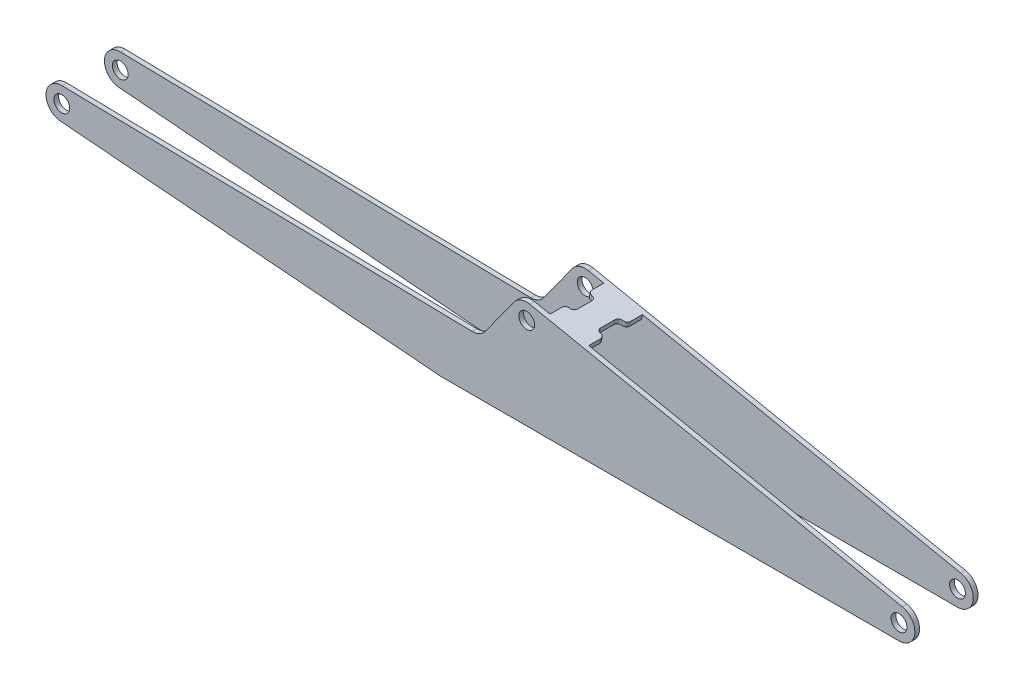
from build123d import *

# Parameters (mm, degrees)
PROFILE_EXTRUDE_DEPTH        = 40
LIGHTNING_BOLT_FILLET_R      = 10
SHELL_CUT_REACH              = 291.378
SHELL_SKETCH_W               = 549.904110801
SHELL_SKETCH_H               = 34
HOLES_START                  = -40
HOLES_SKETCH_R               = 5
HOLES_CUT_DEPTH              = 40
BOWTIE_SUPPORT_EXTRUDE_DEPTH = 3
BOWTIE_SUPPORT_FILLET_R      = 2.5


# Some blends are built 0.0001 mm under size
with BuildPart() as part:
    # Profile Sketch → Profile Extrude (new body)
    with BuildSketch(Plane.XY):
        with BuildLine():
            Line((-25, -34.499500189), (-265.820932486, -14.965628235))
            ThreePointArc((-265.820932486, -14.965628235), (-275, -4.499500189), (-264.823685281, 4.999854285))
            Line((-264.823685281, 4.999854285), (0, 0))
            Line((0, 0), (25, 34.499500189))
            Line((25, 34.499500189), (267.042170119, -14.699900238))
            ThreePointArc((267.042170119, -14.699900238), (275, -25.500499811), (265.050226145, -34.499500189))
            Line((265.050226145, -34.499500189), (-25, -34.499500189))
        make_face()
    extrude(amount=PROFILE_EXTRUDE_DEPTH)

    # Lightning Bolt Fillet
    # the kernel refuses this fillet: 10 mm, written as the material it adds along each edge
    with BuildSketch(Plane(origin=(0, 0, 0), x_dir=(-0.9998218216369521, 0.0188765722144361, 0), z_dir=(0, 0, 1))) as lightning_bolt_fillet_piece_1:
        with BuildLine():
            CenterArc((LIGHTNING_BOLT_FILLET_R * 0.522262066694, -LIGHTNING_BOLT_FILLET_R), LIGHTNING_BOLT_FILLET_R, 90, 55.152715338)
            Line((-LIGHTNING_BOLT_FILLET_R * 0.298415868343, -LIGHTNING_BOLT_FILLET_R * 0.428608954443), (0, 0))
            Line((0, 0), (LIGHTNING_BOLT_FILLET_R * 0.522262066694, 0))
        make_face()
    extrude(amount=40)
    # the kernel refuses this fillet: 10 mm, written as the material it takes off along each edge
    with BuildSketch(Plane(origin=(25, 34.499500189, -16.099347603), x_dir=(0.9799599951405409, -0.19919439732118757, 0), z_dir=(0, 0, 1))) as lightning_bolt_fillet_2_piece_1:
        with BuildLine():
            CenterArc((LIGHTNING_BOLT_FILLET_R * 0.643973904117, -LIGHTNING_BOLT_FILLET_R), LIGHTNING_BOLT_FILLET_R, 90, 65.560956721)
            Line((-LIGHTNING_BOLT_FILLET_R * 0.266428041961, -LIGHTNING_BOLT_FILLET_R * 0.586275095532), (0, 0))
            Line((0, 0), (LIGHTNING_BOLT_FILLET_R * 0.643973904117, 0))
        make_face()
    extrude(amount=72.198695206, mode=Mode.SUBTRACT)
    with BuildSketch(Plane(origin=(-25, -34.499500189, -1.012258703), x_dir=(1, 0, 0), z_dir=(0, 0, 1))) as lightning_bolt_fillet_2_piece_2:
        with BuildLine():
            CenterArc((LIGHTNING_BOLT_FILLET_R * 0.0404903481386, LIGHTNING_BOLT_FILLET_R), LIGHTNING_BOLT_FILLET_R, 265.36268102, 4.63731898)
            Line((-LIGHTNING_BOLT_FILLET_R * 0.040357800163, LIGHTNING_BOLT_FILLET_R * 0.0032735696711), (0, 0))
            Line((0, 0), (LIGHTNING_BOLT_FILLET_R * 0.0404903481386, 0))
        make_face()
    extrude(amount=42.024517407, mode=Mode.SUBTRACT)

    # Shell Cut: up to this plane
    shell_cut_end = Plane(origin=(25, 34.499500189, 40), z_dir=(-0.19919439732118804, -0.9799599951405409, 0))
    # Shell Sketch → Shell Cut (cut, up to the surface)
    with BuildSketch(Plane(origin=(-2.943500576, -36.288584016, 0), x_dir=(0.996726430328903, -0.080848148301631, 0), z_dir=(-0.080848148301631, -0.996726430328903, 0)), mode=Mode.PRIVATE) as shell_cut_sk1:
        with Locations((1.211249587, 20)):
            Rectangle(SHELL_SKETCH_W, SHELL_SKETCH_H)
    shell_cut_tool1 = split(extrude(shell_cut_sk1.sketch, amount=-SHELL_CUT_REACH, mode=Mode.PRIVATE), bisect_by=shell_cut_end, keep=Keep.BOTH, mode=Mode.PRIVATE)
    add(shell_cut_tool1.solids().sort_by_distance((-1.736216, -36.386511, 20))[0], mode=Mode.SUBTRACT)


with BuildPart() as shell_cut_piece_1:
    # of the separate pieces the step leaves, piece 1, a body of its own (shell_cut_pieces)
    add(part.part.solids().sort_by_distance((3.06453365, 4.228995169, 37))[0])


with BuildPart() as shell_cut_piece_2:
    # of the separate pieces the step leaves, piece 2, a body of its own (shell_cut_pieces)
    add(part.part.solids().sort_by_distance((-5.221690109, 0.098585176, 0))[0])


with BuildPart() as holes_cut_tool:
    # Holes Sketch → Holes Cut (new body)
    with BuildSketch(Plane.XY.offset(40).offset(HOLES_START)):
        with Locations((-265.012451003, -4.998363931)):
            Circle(HOLES_SKETCH_R)
        with Locations((29.318742666, 23.4171403)):
            Circle(HOLES_SKETCH_R)
        with Locations((265.050226145, -24.499500189)):
            Circle(HOLES_SKETCH_R)
    extrude(amount=HOLES_CUT_DEPTH)


with BuildPart() as shell_cut_piece_1_1:
    add(shell_cut_piece_1.part)

    # Holes Cut: cut by holes_cut_tool
    add(holes_cut_tool.part, mode=Mode.SUBTRACT)



with BuildPart() as shell_cut_piece_2_1:
    add(shell_cut_piece_2.part)

    # Holes Cut: cut by holes_cut_tool
    add(holes_cut_tool.part, mode=Mode.SUBTRACT)


with BuildPart() as shell_cut_piece_1_2:
    add(shell_cut_piece_1_1.part)

    add(shell_cut_piece_2_1.part)  # Bowtie Support Extrude merges Shell Cut piece 2
    # Bowtie Support Sketch → Bowtie Support Extrude (add)
    with BuildSketch(Plane(origin=(7.726350286, 38.010678463, 0), x_dir=(0.9799599951405408, -0.1991943973211881, 0), z_dir=(0.1991943973211881, 0.9799599951405409, 0))):
        Polygon((39.066631772, -27), (39.066631772, -13), (34.066631772, -13), (34.066631772, -3), (39.066631772, -3), (54.066631772, -3), (59.066631772, -3), (59.066631772, -13), (54.066631772, -13), (54.066631772, -27), (59.066631772, -27), (59.066631772, -37), (54.066631772, -37), (39.066631772, -37), (34.066631772, -37), (34.066631772, -27), align=None)
    extrude(amount=-BOWTIE_SUPPORT_EXTRUDE_DEPTH)

    # Bowtie Support Fillet
    bowtie_support_fillet_edges = [shell_cut_piece_1_2.edges().sort_by_distance(p)[0] for p in [
        (60.410694898, 25.77096834, 13),
        (60.410694898, 25.77096834, 27),
        (45.711294971, 28.758884299, 13),
        (45.711294971, 28.758884299, 27),
    ]]
    fillet(bowtie_support_fillet_edges, radius=BOWTIE_SUPPORT_FILLET_R)
    bowtie_support_fillet_2_edges = [shell_cut_piece_1_2.edges().sort_by_distance(p)[0] for p in [
        (65.310494873, 24.774996353, 13),
        (65.310494873, 24.774996353, 27),
        (40.811494995, 29.754856286, 13),
        (40.811494995, 29.754856286, 27),
    ]]
    fillet(bowtie_support_fillet_2_edges, radius=BOWTIE_SUPPORT_FILLET_R - 0.0001)  # a hair under: the kernel refuses the full size


solid = shell_cut_piece_1_2.part
